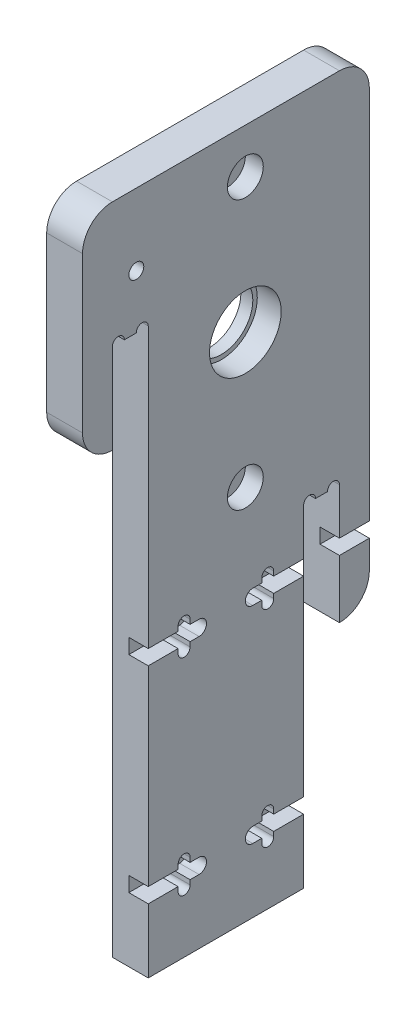
from build123d import *

# Parameters (mm, degrees)
SKETCH1_W                          = 63
SKETCH1_H                          = 120
SKETCH1_R                          = 10.5
BOSS_EXTRUDE1_DEPTH                = 12
BOSS_EXTRUDE2_DEPTH                = 12
SKETCH9_W                          = 52
SKETCH9_H                          = 111
BOSS_EXTRUDE3_DEPTH                = 12
SKETCH11_W                         = 10
SKETCH11_H                         = 160
BOSS_EXTRUDE4_DEPTH                = 12
F_5_0_5_DIAMETER_HOLE1_D           = 5
LINEAR_RAIL_MOUNT_HOLE_D           = 5
LINEAR_RAIL_MOUNT_HOLE_CBORE_D     = 12
LINEAR_RAIL_MOUNT_HOLE_CBORE_DEPTH = 6
SKETCH27_R                         = 12
CUT_EXTRUDE1_DEPTH                 = 8
CUT_EXTRUDE2_REACH                 = 181.876
FILLET1_R                          = 10
CUT_EXTRUDE3_DEPTH                 = 8
CUT_EXTRUDE4_DEPTH                 = 6.5
LPATTERN1_COUNT                    = 2
LPATTERN1_PITCH                    = 69
MIRROR1_COPY_1_DEPTH               = 8
MIRROR1_COPY_2_DEPTH               = 6.5


with BuildPart() as part:
    # Sketch1 → Boss-Extrude1 (new body)
    with BuildSketch(Plane(origin=(0, 0, 0), x_dir=(0, 0, -1), z_dir=(1, 0, 0))):
        Rectangle(SKETCH1_W, SKETCH1_H)
        Circle(SKETCH1_R, mode=Mode.SUBTRACT)
    extrude(amount=BOSS_EXTRUDE1_DEPTH)

    # Sketch8 → Boss-Extrude2 (add)
    with BuildSketch(Plane.ZY):
        Polygon((44.5, 18), (44.5, -12), (54.5, -12), (54.5, 60), (31.5, 60), (31.5, -60), (32.5, -60), (32.5, 18), align=None)
    extrude(amount=-BOSS_EXTRUDE2_DEPTH)

    # Sketch9 → Boss-Extrude3 (add)
    with BuildSketch(Plane.ZY):
        with Locations((6.5, -115.5)):
            Rectangle(SKETCH9_W, SKETCH9_H)
    extrude(amount=-BOSS_EXTRUDE3_DEPTH)

    # Sketch11 → Boss-Extrude4 (add)
    with BuildSketch(Plane(origin=(12, 0, 0), x_dir=(0, 0, -1), z_dir=(1, 0, 0))):
        with Locations((36.5, -20)):
            Rectangle(SKETCH11_W, SKETCH11_H)
    extrude(amount=-BOSS_EXTRUDE4_DEPTH)

    # Ø5.0 (5) Diameter Hole1 (through all)
    with Locations(Plane(origin=(12, 0, 0), x_dir=(0, 0, -1), z_dir=(1, 0, 0))):
        with Locations((-36.5, 36)):
            Hole(F_5_0_5_DIAMETER_HOLE1_D / 2)

    # Linear Rail Mount Hole (through all)
    with Locations(Plane(origin=(12, 0, 0), x_dir=(0, 0, -1), z_dir=(1, 0, 0))):
        with Locations((0, -45), (0, 45)):
            CounterBoreHole(LINEAR_RAIL_MOUNT_HOLE_D / 2, LINEAR_RAIL_MOUNT_HOLE_CBORE_D / 2, LINEAR_RAIL_MOUNT_HOLE_CBORE_DEPTH)

    # Sketch27 → Cut-Extrude1 (cut)
    with BuildSketch(Plane(origin=(12, 0, 0), x_dir=(0, 0, -1), z_dir=(1, 0, 0))):
        Circle(SKETCH27_R)
    extrude(amount=-CUT_EXTRUDE1_DEPTH, mode=Mode.SUBTRACT)

    # Sketch28 → Cut-Extrude2 (cut, up to next)
    with BuildSketch(Plane(origin=(12, 0, 0), x_dir=(0, 0, -1), z_dir=(1, 0, 0)), mode=Mode.PRIVATE) as cut_extrude2_sk1:
        with BuildLine():
            Line((-44.5, 18), (-40.5, 18))
            ThreePointArc((-40.5, 18), (-42.5, 20), (-44.5, 18))
        make_face()
    cut_extrude2_tool1 = extrude(cut_extrude2_sk1.sketch, amount=-CUT_EXTRUDE2_REACH, mode=Mode.PRIVATE) & part.part
    # Sketch28 → Cut-Extrude2 (cut, up to next)
    with BuildSketch(Plane(origin=(12, 0, 0), x_dir=(0, 0, -1), z_dir=(1, 0, 0)), mode=Mode.PRIVATE) as cut_extrude2_sk2:
        with BuildLine():
            Line((-36.5, 18), (-32.5, 18))
            ThreePointArc((-32.5, 18), (-34.5, 20), (-36.5, 18))
        make_face()
    cut_extrude2_tool2 = extrude(cut_extrude2_sk2.sketch, amount=-CUT_EXTRUDE2_REACH, mode=Mode.PRIVATE) & part.part
    # Sketch28 → Cut-Extrude2 (cut, up to next)
    with BuildSketch(Plane(origin=(12, 0, 0), x_dir=(0, 0, -1), z_dir=(1, 0, 0)), mode=Mode.PRIVATE) as cut_extrude2_sk3:
        with BuildLine():
            Line((19.5, -60), (23.5, -60))
            ThreePointArc((23.5, -60), (21.5, -58), (19.5, -60))
        make_face()
    cut_extrude2_tool3 = extrude(cut_extrude2_sk3.sketch, amount=-CUT_EXTRUDE2_REACH, mode=Mode.PRIVATE) & part.part
    # Sketch28 → Cut-Extrude2 (cut, up to next)
    with BuildSketch(Plane(origin=(12, 0, 0), x_dir=(0, 0, -1), z_dir=(1, 0, 0)), mode=Mode.PRIVATE) as cut_extrude2_sk4:
        with BuildLine():
            Line((27.5, -60), (31.5, -60))
            ThreePointArc((31.5, -60), (29.5, -58), (27.5, -60))
        make_face()
    cut_extrude2_tool4 = extrude(cut_extrude2_sk4.sketch, amount=-CUT_EXTRUDE2_REACH, mode=Mode.PRIVATE) & part.part
    add(cut_extrude2_tool1.solids().sort_by_distance((12, 18.848826, 42.5))[0], mode=Mode.SUBTRACT)
    add(cut_extrude2_tool2.solids().sort_by_distance((12, 18.848826, 34.5))[0], mode=Mode.SUBTRACT)
    add(cut_extrude2_tool3.solids().sort_by_distance((12, -59.151174, -21.5))[0], mode=Mode.SUBTRACT)
    add(cut_extrude2_tool4.solids().sort_by_distance((12, -59.151174, -29.5))[0], mode=Mode.SUBTRACT)

    # Fillet1
    fillet1_edges = [part.edges().sort_by_distance(p)[0] for p in [
        (6, -12, 54.5),
        (6, -100, -41.5),
        (6, 60, 54.5),
        (6, 60, -41.5),
    ]]
    fillet(fillet1_edges, radius=FILLET1_R - 0.0001)  # a hair under: the kernel refuses the full size

    # Sketch29 → Cut-Extrude3 (cut)
    with BuildSketch(Plane(origin=(12, 0, 0), x_dir=(0, 0, -1), z_dir=(1, 0, 0))):
        with BuildLine():
            Line((9.5, -143), (9.5, -151))
            ThreePointArc((9.5, -151), (7.5, -153), (5.5, -151))
            Line((5.5, -151), (5.5, -143))
            ThreePointArc((5.5, -143), (7.5, -141), (9.5, -143))
        make_face()
    cut_extrude3 = extrude(amount=-CUT_EXTRUDE3_DEPTH, mode=Mode.SUBTRACT)

    # Sketch31 → Cut-Extrude4 (cut)
    with BuildSketch(Plane(origin=(12, 0, 0), x_dir=(0, 0, -1), z_dir=(1, 0, 0))):
        with BuildLine():
            Line((65.397486198, -149.5), (2.5, -149.5))
            ThreePointArc((2.5, -149.5), (0, -147), (2.5, -144.5))
            Line((2.5, -144.5), (65.397486198, -144.5))
            ThreePointArc((65.397486198, -144.5), (67.897486198, -147), (65.397486198, -149.5))
        make_face()
    cut_extrude4 = extrude(amount=-CUT_EXTRUDE4_DEPTH, mode=Mode.SUBTRACT)

    # LPattern1: Cut-Extrude3, Cut-Extrude4 ×2
    with Locations(*[(0, i * LPATTERN1_PITCH, 0) for i in range(1, LPATTERN1_COUNT)]):
        add(cut_extrude3, mode=Mode.SUBTRACT)
        add(cut_extrude4, mode=Mode.SUBTRACT)

    # Mirror1: Cut-Extrude3, Cut-Extrude4 across plane
    add(cut_extrude3.mirror(Plane(origin=(0, 0, 6.5), x_dir=(1, 0, 0), z_dir=(0, 0, -1))), mode=Mode.SUBTRACT)
    add(cut_extrude4.mirror(Plane(origin=(0, 0, 6.5), x_dir=(1, 0, 0), z_dir=(0, 0, -1))), mode=Mode.SUBTRACT)

    # Mirror1 copy 1 sketch → Mirror1 copy 1 (cut)
    with BuildSketch(Plane(origin=(12, 69, 13), x_dir=(0, 0, 1), z_dir=(1, 0, 0))):
        with BuildLine():
            Line((9.5, 143), (9.5, 151))
            ThreePointArc((9.5, 151), (7.5, 153), (5.5, 151))
            Line((5.5, 151), (5.5, 143))
            ThreePointArc((5.5, 143), (7.5, 141), (9.5, 143))
        make_face()
    extrude(amount=-MIRROR1_COPY_1_DEPTH, mode=Mode.SUBTRACT)

    # Mirror1 copy 2 sketch → Mirror1 copy 2 (cut)
    with BuildSketch(Plane(origin=(12, 69, 13), x_dir=(0, 0, 1), z_dir=(1, 0, 0))):
        with BuildLine():
            Line((65.397486198, 149.5), (2.5, 149.5))
            ThreePointArc((2.5, 149.5), (0, 147), (2.5, 144.5))
            Line((2.5, 144.5), (65.397486198, 144.5))
            ThreePointArc((65.397486198, 144.5), (67.897486198, 147), (65.397486198, 149.5))
        make_face()
    extrude(amount=-MIRROR1_COPY_2_DEPTH, mode=Mode.SUBTRACT)


solid = part.part
